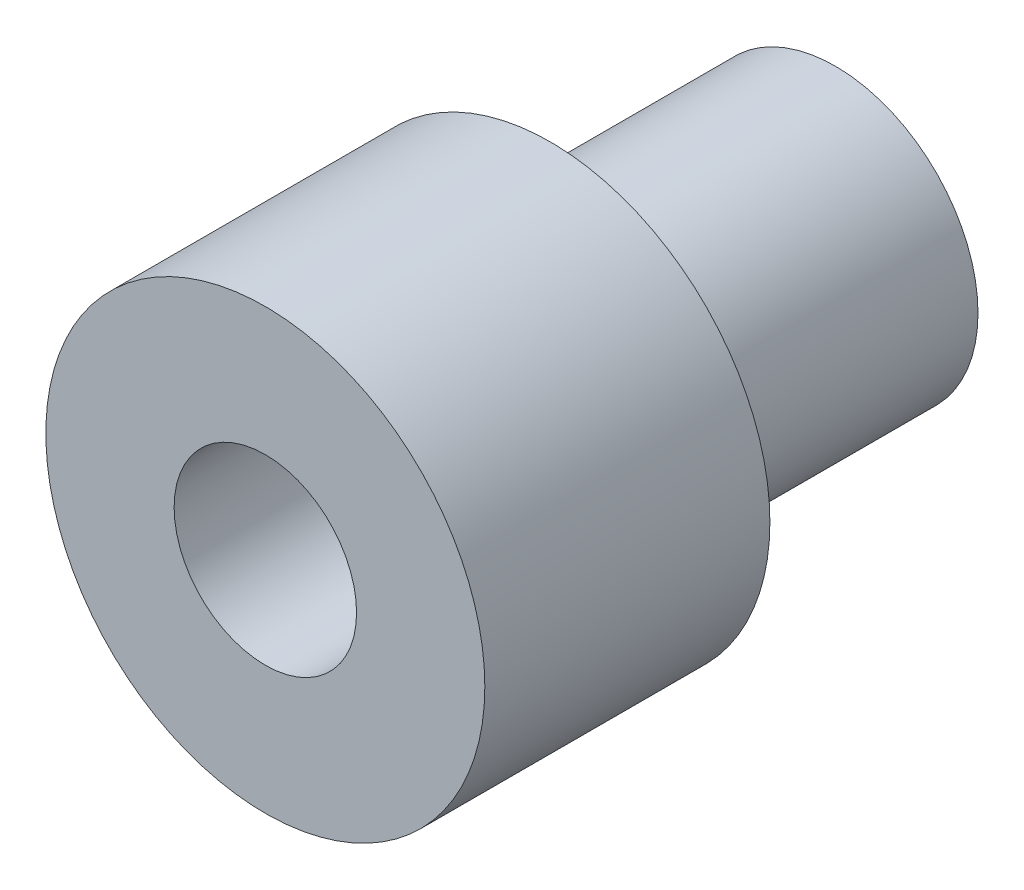
from build123d import *


with BuildPart() as part:
    # Sketch1 → Revolve1 (revolve)
    with BuildSketch(Plane(origin=(0, 0, 0), x_dir=(0, 0, -1), z_dir=(1, 0, 0))):
        Polygon((0, 1.6), (0, 3.85), (5, 3.85), (5, 2.5), (10, 2.5), (10, 1.6), align=None)
    revolve(axis=Axis((0, 0, 0), (0, 0, -1)))


solid = part.part
